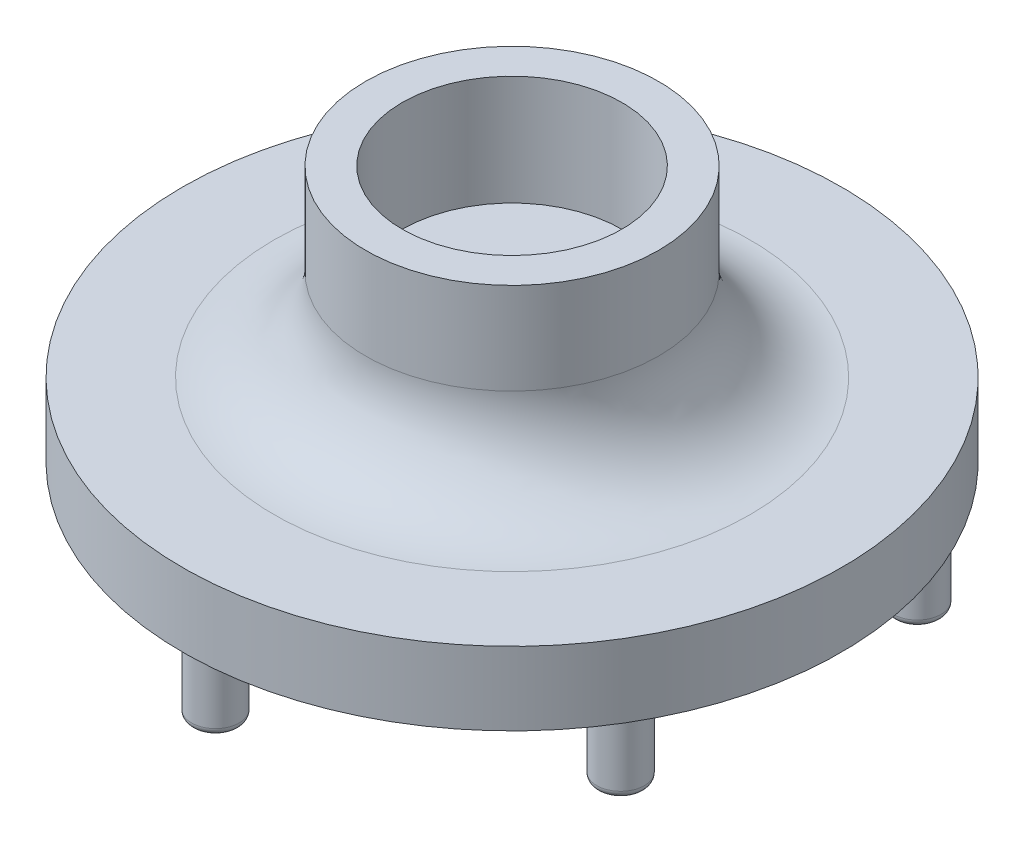
from build123d import *

# Parameters (mm, degrees)
SKETCH2_R           = 6.5000000000000036
BOSS_EXTRUDE1_DEPTH = 40
CIRPATTERN1_COUNT   = 6
FILLET1_R           = 25
FILLET2_R           = 15
FILLET5_R           = 2


with BuildPart() as part:
    # Sketch1 → Revolve1 (revolve)
    with BuildSketch(Plane.XY):
        Polygon((5e-16, 75), (0, 0), (-30, 0), (-30, 29.999999999999996), (-50.00000000000002, 29.999999999999993), (-50.00000000000002, 35), (-90.00000000000003, 34.99999999999999), (-90.00000000000003, 54.99999999999999), (-40.000000000000014, 54.99999999999999), (-40, 105), (-30.000000000000004, 105), (-30, 75), align=None)
    revolve(axis=Axis((5e-16, 75, 0), (-1e-17, -1, 0)))

    # Sketch2 → Boss-Extrude1 (add)
    with BuildSketch(Plane(origin=(3.7e-16, 54.99999999999999, 0), x_dir=(1, -1e-17, 0), z_dir=(1e-17, 1, 0))):
        with Locations(Location((0, 81, 0), (0, 0, 180))):
            Circle(SKETCH2_R)
    boss_extrude1 = extrude(amount=-BOSS_EXTRUDE1_DEPTH)

    # CirPattern1: Boss-Extrude1 ×6 about axis
    cirpattern1_axis = Axis((-9.547e-14, 0, 1.87e-15), (0, 1, 0))
    for i in range(1, CIRPATTERN1_COUNT):
        add(boss_extrude1.rotate(cirpattern1_axis, i * 360 / CIRPATTERN1_COUNT))

    # Fillet1
    # the kernel refuses this fillet: 25 mm, written as the material it adds along each edge
    with BuildSketch(Plane(origin=(2e-16, 30, 0), x_dir=(-1, 0, 0), z_dir=(0, 0, 1))) as fillet1_piece_1:
        with BuildLine():
            CenterArc((55, 24.494897427831788), FILLET1_R, 180, 78.46304096718455)
            Line((50.00000000000002, 3.55e-15), (49.90000000000002, -0.4898979485566315))
            ThreePointArc((49.90000000000002, -0.4898979485566315), (40.000000000000014, -0.5), (30, -0.5))
            Line((30, -0.5), (29.5, 0))
            Line((29.5, 0), (29.5, 24.494897427831788))
            Line((29.5, 24.494897427831788), (30, 24.494897427831788))
        make_face()
    revolve(axis=Axis((2e-16, 30, 0), (-1e-17, -1, 0)))
    with BuildSketch(Plane(origin=(3.7e-16, 54.99999999999999, 0), x_dir=(-1, 0, 0), z_dir=(0, 0, 1))) as fillet1_piece_2:
        with BuildLine():
            CenterArc((40.000000000000014 + FILLET1_R, -FILLET1_R), FILLET1_R, 90, 89.99999999999997)
            Line((40.000000000000014, -FILLET1_R), (40.000000000000014 - FILLET1_R * 0.02, -FILLET1_R))
            Line((40.000000000000014 - FILLET1_R * 0.02, -FILLET1_R), (40.000000000000014 - FILLET1_R * 0.02, FILLET1_R * 0.02))
            Line((40.000000000000014 - FILLET1_R * 0.02, FILLET1_R * 0.02), (40.000000000000014 + FILLET1_R, FILLET1_R * 0.02))
            Line((40.000000000000014 + FILLET1_R, FILLET1_R * 0.02), (40.000000000000014 + FILLET1_R, -7.11e-15))
        make_face()
    revolve(axis=Axis((3.7e-16, 54.99999999999999, 0), (-1e-17, -1, 0)))

    # Fillet2
    fillet2_edges = [part.edges().sort_by_distance(p)[0] for p in [
        (30, -2e-16, -1.7e-14),
    ]]
    fillet(fillet2_edges, radius=FILLET2_R)

    # Fillet5
    fillet5_edges = [part.edges().sort_by_distance(p)[0] for p in [
        (6.5000000000000036, 14.999999999999993, -81),
        (-66.89805770653957, 14.999999999999993, -46.12916512459895),
        (-73.39805770653969, 14.999999999999993, 34.870834875401044),
        (-6.500000000000204, 14.999999999999993, 81),
        (66.89805770653936, 14.999999999999993, 46.12916512459897),
        (73.39805770653949, 14.999999999999993, -34.870834875401066),
    ]]
    fillet(fillet5_edges, radius=FILLET5_R)


solid = part.part
